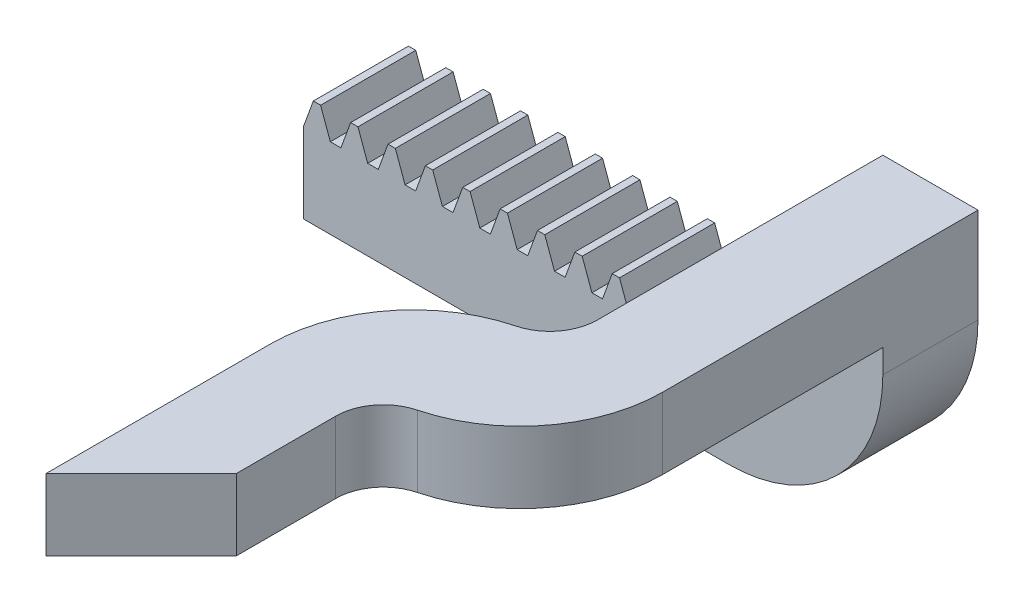
from build123d import *

# Parameters (mm, degrees)
BLANKSKE_W                  = 50
BLANKSKE_H                  = 9
BLANK_DEPTH                 = 12
TOOTHCUTSIM_DEPTH           = 53.201532545
TEETHCUTS_COUNT             = 17
TEETHCUTS_PITCH             = 3.14159265
SKETCH1_W                   = 50
SKETCH1_H                   = 10.518808777
CUT_EXTRUDE1_DEPTH          = 4
SKETCH2_W                   = 8
SKETCH2_H                   = 6.765098998
BOSS_EXTRUDE1_DEPTH         = 10
SKETCH3_W                   = 8
SKETCH3_H                   = 21
BOSS_EXTRUDE2_DEPTH         = 8
SKETCH4_W                   = 8
SKETCH4_H                   = 6
BOSS_EXTRUDE3_DEPTH         = 30
SKETCH5_W                   = 10
SKETCH5_H                   = 6
BOSS_EXTRUDE4_DEPTH         = 12
BODY_MOVE_COPY3_START       = -12
BODY_MOVE_COPY3_DEPTH       = 12
BODY_MOVE_COPY3_START_2     = 16
BODY_MOVE_COPY3_2_OUTLINE_W = 12
BODY_MOVE_COPY3_2_OUTLINE_H = 6
BODY_MOVE_COPY3_2_DEPTH     = 10
BODY_MOVE_COPY3_3_DEPTH     = 8
BODY_MOVE_COPY3_START_3     = 28
BODY_MOVE_COPY3_4_OUTLINE_W = 20
BODY_MOVE_COPY3_4_OUTLINE_H = 6
BODY_MOVE_COPY3_4_DEPTH     = 10
BODY_MOVE_COPY3_START_4     = 26
BODY_MOVE_COPY3_5_OUTLINE_W = 8
BODY_MOVE_COPY3_5_OUTLINE_H = 6
BODY_MOVE_COPY3_5_DEPTH     = 2
SKETCH8_R                   = 3
CUT_EXTRUDE2_DEPTH          = 4
FILLET1_R                   = 8
FILLET2_R                   = 13
SKETCH9_W                   = 8
SKETCH9_H                   = 20.359047751
BOSS_EXTRUDE5_DEPTH         = 6
FILLET3_R                   = 4
FILLET4_R                   = 12
CUT_EXTRUDE3_DEPTH          = 10
SKETCH11_W                  = 0.88887074
SKETCH11_H                  = 6.79103927
CUT_EXTRUDE4_DEPTH          = 10
CHAMFER10_SIZE              = 8


# Read off the part's stored shape, not the designer's step: Body-Move/Copy3
with BuildPart() as part:
    # BlankSke → Blank (new body)
    with BuildSketch(Plane.XY):
        with Locations((25, 4.5)):
            Rectangle(BLANKSKE_W, BLANKSKE_H)
    extrude(amount=-BLANK_DEPTH)

    # TooCutSkeSim → ToothCutSim (cut, through all)
    with BuildSketch(Plane.XY):
        Polygon((0.44443537, 6.75), (-0.44443537, 6.75), (-1.272613241, 9.0254), (1.272613241, 9.0254), align=None)
    toothcutsim = extrude(amount=-TOOTHCUTSIM_DEPTH, mode=Mode.SUBTRACT)

    # TeethCuts: ToothCutSim ×17
    with Locations(*[(i * TEETHCUTS_PITCH, 0, 0) for i in range(1, TEETHCUTS_COUNT)]):
        add(toothcutsim, mode=Mode.SUBTRACT)

    # Sketch1 → Cut-Extrude1 (cut)
    with BuildSketch(Plane.XY):
        with Locations((25, 5.259404389)):
            Rectangle(SKETCH1_W, SKETCH1_H)
    extrude(amount=-CUT_EXTRUDE1_DEPTH, mode=Mode.SUBTRACT)

    # Sketch2 → Boss-Extrude1 (add)
    with BuildSketch(Plane(origin=(50, 0, 0), x_dir=(0, 0, -1), z_dir=(1, 0, 0))):
        with Locations((8, 3.382549499)):
            Rectangle(SKETCH2_W, SKETCH2_H)
    extrude(amount=BOSS_EXTRUDE1_DEPTH)

    # Sketch3 → Boss-Extrude2 (add)
    with BuildSketch(Plane.XY.offset(-4)):
        with Locations((64, 10.5)):
            Rectangle(SKETCH3_W, SKETCH3_H)
    extrude(amount=-BOSS_EXTRUDE2_DEPTH)

    # Sketch4 → Boss-Extrude3 (add)
    with BuildSketch(Plane.XY.offset(-4)):
        with Locations((64, 18)):
            Rectangle(SKETCH4_W, SKETCH4_H)
    extrude(amount=BOSS_EXTRUDE3_DEPTH)

    # Sketch5 → Boss-Extrude4 (add)
    with BuildSketch(Plane.ZY.offset(-60)):
        with Locations((21, 18)):
            Rectangle(SKETCH5_W, SKETCH5_H)
    extrude(amount=BOSS_EXTRUDE4_DEPTH)

    # Body-Move/Copy3 outline → Body-Move/Copy3 (cut)
    with BuildSketch(Plane.XY.offset(BODY_MOVE_COPY3_START)):
        Polygon((68, 21), (60, 21), (60, 6.765098998), (50, 6.765098998), (50, 6.75), (49.82104703, 6.75), (49.002114003, 9), (48.387258147, 9), (47.56832512, 6.75), (46.67945438, 6.75), (45.860521353, 9), (45.245665497, 9), (44.42673247, 6.75), (43.53786173, 6.75), (42.718928703, 9), (42.104072847, 9), (41.28513982, 6.75), (40.39626908, 6.75), (39.577336053, 9), (38.962480197, 9), (38.14354717, 6.75), (37.25467643, 6.75), (36.435743403, 9), (35.820887547, 9), (35.00195452, 6.75), (34.11308378, 6.75), (33.294150753, 9), (32.679294897, 9), (31.86036187, 6.75), (30.97149113, 6.75), (30.152558103, 9), (29.537702247, 9), (28.71876922, 6.75), (27.82989848, 6.75), (27.010965453, 9), (26.396109597, 9), (25.57717657, 6.75), (24.68830583, 6.75), (23.869372803, 9), (23.254516947, 9), (22.43558392, 6.75), (21.54671318, 6.75), (20.727780153, 9), (20.112924297, 9), (19.29399127, 6.75), (18.40512053, 6.75), (17.586187503, 9), (16.971331647, 9), (16.15239862, 6.75), (15.26352788, 6.75), (14.444594853, 9), (13.829738997, 9), (13.01080597, 6.75), (12.12193523, 6.75), (11.303002203, 9), (10.688146347, 9), (9.86921332, 6.75), (8.98034258, 6.75), (8.161409553, 9), (7.546553697, 9), (6.72762067, 6.75), (5.83874993, 6.75), (5.019816903, 9), (4.404961047, 9), (3.58602802, 6.75), (2.69715728, 6.75), (1.878224253, 9), (1.263368397, 9), (0.44443537, 6.75), (0, 6.75), (0, 0), (68, 0), align=None)
    extrude(amount=BODY_MOVE_COPY3_DEPTH, mode=Mode.SUBTRACT)

    # Body-Move_Copy3 2 outline → Body-Move_Copy3 2 (cut)
    with BuildSketch(Plane.XY.offset(BODY_MOVE_COPY3_START_2)):
        with Locations((54, 18)):
            Rectangle(BODY_MOVE_COPY3_2_OUTLINE_W, BODY_MOVE_COPY3_2_OUTLINE_H)
    extrude(amount=BODY_MOVE_COPY3_2_DEPTH, mode=Mode.SUBTRACT)

    # Body-Move_Copy3 3 outline → Body-Move_Copy3 3 (add)
    with BuildSketch(Plane.XY):
        Polygon((68, 15), (60, 15), (60, 6.765098998), (50, 6.765098998), (50, 6.75), (49.82104703, 6.75), (49.002114003, 9), (48.387258147, 9), (47.56832512, 6.75), (46.67945438, 6.75), (45.860521353, 9), (45.245665497, 9), (44.42673247, 6.75), (43.53786173, 6.75), (42.718928703, 9), (42.104072847, 9), (41.28513982, 6.75), (40.39626908, 6.75), (39.577336053, 9), (38.962480197, 9), (38.14354717, 6.75), (37.25467643, 6.75), (36.435743403, 9), (35.820887547, 9), (35.00195452, 6.75), (34.11308378, 6.75), (33.294150753, 9), (32.679294897, 9), (31.86036187, 6.75), (30.97149113, 6.75), (30.152558103, 9), (29.537702247, 9), (28.71876922, 6.75), (27.82989848, 6.75), (27.010965453, 9), (26.396109597, 9), (25.57717657, 6.75), (24.68830583, 6.75), (23.869372803, 9), (23.254516947, 9), (22.43558392, 6.75), (21.54671318, 6.75), (20.727780153, 9), (20.112924297, 9), (19.29399127, 6.75), (18.40512053, 6.75), (17.586187503, 9), (16.971331647, 9), (16.15239862, 6.75), (15.26352788, 6.75), (14.444594853, 9), (13.829738997, 9), (13.01080597, 6.75), (12.12193523, 6.75), (11.303002203, 9), (10.688146347, 9), (9.86921332, 6.75), (8.98034258, 6.75), (8.161409553, 9), (7.546553697, 9), (6.72762067, 6.75), (5.83874993, 6.75), (5.019816903, 9), (4.404961047, 9), (3.58602802, 6.75), (2.69715728, 6.75), (1.878224253, 9), (1.263368397, 9), (0.44443537, 6.75), (0, 6.75), (0, 0), (68, 0), align=None)
    extrude(amount=BODY_MOVE_COPY3_3_DEPTH)



with BuildPart() as body_2:
    # Body-Move_Copy3 4 outline → Body-Move_Copy3 4 (new body)
    with BuildSketch(Plane.XY.offset(BODY_MOVE_COPY3_START_3)):
        with Locations((58, 18)):
            Rectangle(BODY_MOVE_COPY3_4_OUTLINE_W, BODY_MOVE_COPY3_4_OUTLINE_H)
    extrude(amount=BODY_MOVE_COPY3_4_DEPTH)


with BuildPart() as part_1:
    add(part.part)

    add(body_2.part)  # Body-Move_Copy3 5 merges body 2
    # Body-Move_Copy3 5 outline → Body-Move_Copy3 5 (add)
    with BuildSketch(Plane.XY.offset(BODY_MOVE_COPY3_START_4)):
        with Locations((64, 18)):
            Rectangle(BODY_MOVE_COPY3_5_OUTLINE_W, BODY_MOVE_COPY3_5_OUTLINE_H)
    extrude(amount=BODY_MOVE_COPY3_5_DEPTH)

    # Sketch8 → Cut-Extrude2 (cut)
    with BuildSketch(Plane.XZ):
        with Locations(Location((48, 4, 0), (0, 0, 270))):
            Circle(SKETCH8_R)
    extrude(amount=-CUT_EXTRUDE2_DEPTH, mode=Mode.SUBTRACT)

    # Fillet1
    fillet1_edges = [part_1.edges().sort_by_distance(p)[0] for p in [
        (60, 6.765098998, 4),
    ]]
    fillet(fillet1_edges, radius=FILLET1_R)

    # Fillet2
    fillet2_edges = [part_1.edges().sort_by_distance(p)[0] for p in [
        (68, 0, 4),
    ]]
    fillet(fillet2_edges, radius=FILLET2_R)

    # Sketch9 → Boss-Extrude5 (add)
    with BuildSketch(Plane(origin=(0, 21, 0), x_dir=(1, 0, 0), z_dir=(0, 1, 0))):
        with Locations((52, -48.179523876)):
            Rectangle(SKETCH9_W, SKETCH9_H)
    extrude(amount=-BOSS_EXTRUDE5_DEPTH)

    # Fillet3
    fillet3_edges = [part_1.edges().sort_by_distance(p)[0] for p in [
        (60, 18, 28),
        (56, 18, 38),
    ]]
    fillet(fillet3_edges, radius=FILLET3_R)

    # Fillet4
    fillet4_edges = [part_1.edges().sort_by_distance(p)[0] for p in [
        (48, 18, 28),
        (68, 18, 38),
    ]]
    fillet(fillet4_edges, radius=FILLET4_R)

    # Sketch10 → Cut-Extrude3 (cut)
    with BuildSketch(Plane(origin=(0, 0, 0), x_dir=(-1, 0, 0), z_dir=(0, 0, -1))):
        Polygon((-18.40512053, 6.75), (-18.40512053, 0), (5.217531279, 0), (5.217531279, 6.75), (5.217531279, 11.737070905), (-18.40512053, 11.737070905), align=None)
    extrude(amount=-CUT_EXTRUDE3_DEPTH, mode=Mode.SUBTRACT)

    # Sketch11 → Cut-Extrude4 (cut)
    with BuildSketch(Plane(origin=(0, 0, 0), x_dir=(-1, 0, 0), z_dir=(0, 0, -1))):
        with Locations((-18.8495559, 3.354480365)):
            Rectangle(SKETCH11_W, SKETCH11_H)
    extrude(amount=-CUT_EXTRUDE4_DEPTH, mode=Mode.SUBTRACT)

    # Chamfer10
    chamfer10_edges = [part_1.edges().sort_by_distance(p)[0] for p in [
        (56, 18, 58.359047751),
    ]]
    chamfer(chamfer10_edges, length=CHAMFER10_SIZE - 0.0001)  # a hair under: the kernel refuses the full size


solid = part_1.part
